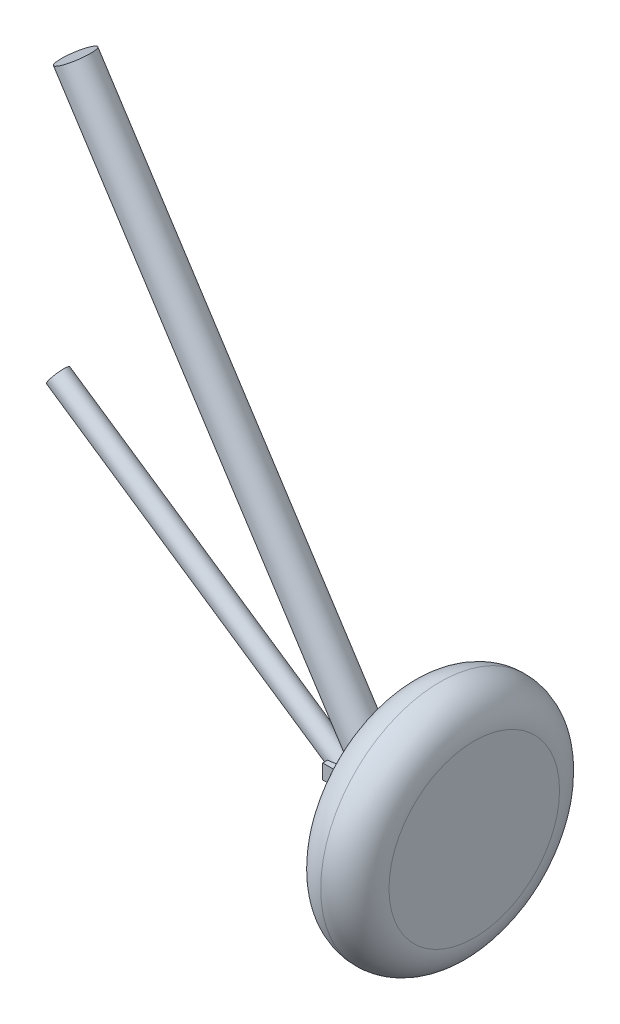
from build123d import *

# Parameters (mm, degrees)
Y_KSEKLIK_EKSTR_ZYON1_DEPTH      = 1
Y_KSEKLIK_EKSTR_ZYON1_DEPTH_BACK = 1
IZIM1_R                          = 3.5
RADYUS1_R                        = 1
RADYUS2_R                        = 1
IZIM2_W                          = 0.864396699
IZIM2_H                          = 0.432198349
Y_KSEKLIK_EKSTR_ZYON2_DEPTH      = 2


with BuildPart() as part:
    # Çizim1 → Yükseklik-Ekstrüzyon1 (new, two sides: drawn at the far end of the back side and taken through both)
    with BuildSketch(Plane(origin=(0, 0, 0), x_dir=(0, 0, -1), z_dir=(1, 0, 0)).offset(-Y_KSEKLIK_EKSTR_ZYON1_DEPTH_BACK)):
        Circle(IZIM1_R)
    extrude(amount=Y_KSEKLIK_EKSTR_ZYON1_DEPTH + Y_KSEKLIK_EKSTR_ZYON1_DEPTH_BACK)

    # Radyus1
    radyus1_edges = [part.edges().sort_by_distance(p)[0] for p in [
        (1, 0, 3.5),
    ]]
    fillet(radyus1_edges, radius=RADYUS1_R - 0.0001)  # a hair under: the kernel refuses the full size

    # Radyus2
    radyus2_edges = [part.edges().sort_by_distance(p)[0] for p in [
        (-1, 0, 3.5),
    ]]
    fillet(radyus2_edges, radius=RADYUS2_R - 0.0001)  # a hair under: the kernel refuses the full size

    # Çizim2 → Yükseklik-Ekstrüzyon2 (add)
    with BuildSketch(Plane.ZY.offset(1)):
        with Locations((0.009004132, -0.054024793)):
            Rectangle(IZIM2_W, IZIM2_H)
    extrude(amount=Y_KSEKLIK_EKSTR_ZYON2_DEPTH)

    # Çizim3 → Döndür-İnce1 (revolve)
    with BuildSketch(Plane.XY, mode=Mode.PRIVATE) as d_nd_r_nce1_sk:
        Polygon((-1.61474818, 0), (-10.685328889, 14.04226294), (-11.105326504, 13.77096605), (-2.034745795, -0.27129689), align=None)
    revolve(d_nd_r_nce1_sk.sketch.rotate(Axis((-1.61474818, 0, 0), (-0.5425937809668819, 0.8399952314484074, 0)), 180), axis=Axis((-1.61474818, 0, 0), (-0.5425937809668819, 0.8399952314484074, 0)))

    # Çizim4 → Döndür-İnce2 (revolve)
    with BuildSketch(Plane.XY, mode=Mode.PRIVATE) as d_nd_r_nce2_sk:
        Polygon((-2.810513045, 0), (-11.199411855, 5.686357854), (-11.367738433, 5.438031127), (-2.978839623, -0.248326726), align=None)
    revolve(d_nd_r_nce2_sk.sketch.rotate(Axis((-2.810513045, 0, 0), (-0.8277557549139161, 0.561088593901973, 0)), 180), axis=Axis((-2.810513045, 0, 0), (-0.8277557549139161, 0.561088593901973, 0)))


solid = part.part
